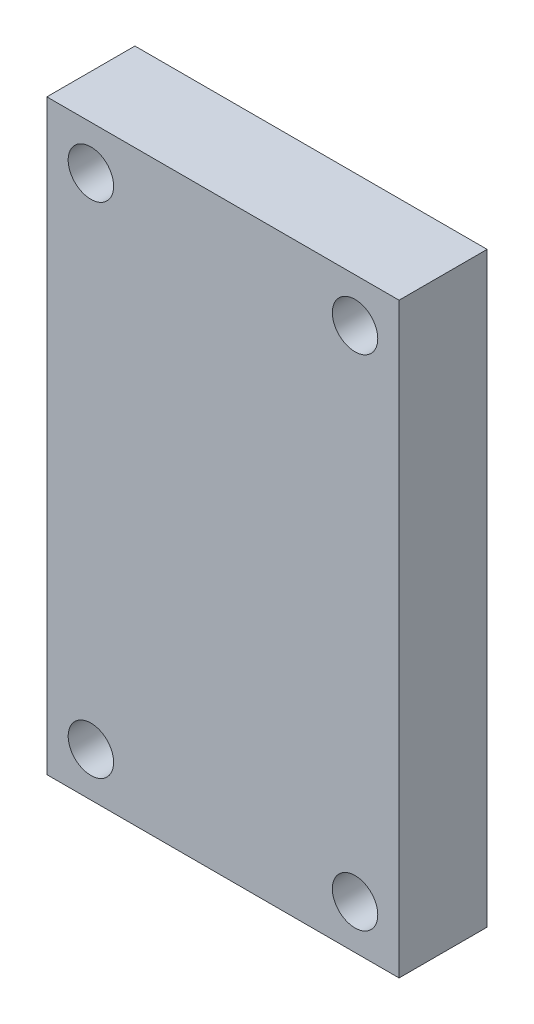
from build123d import *

# Parameters (mm, degrees)
SKETCH1_W                    = 38.1
SKETCH1_H                    = 63.5
BOSS_EXTRUDE1_DEPTH          = 9.525
F_10_0_1935_DIAMETER_HOLE1_D = 4.9149


with BuildPart() as part:
    # Sketch1 → Boss-Extrude1 (new body)
    with BuildSketch(Plane.XY):
        with Locations((19.05, 31.75)):
            Rectangle(SKETCH1_W, SKETCH1_H)
    extrude(amount=BOSS_EXTRUDE1_DEPTH)

    # #10 (0.1935) Diameter Hole1 (through all)
    with Locations(Plane.XY.offset(9.525)):
        with Locations((4.7625, 58.7375), (33.3375, 58.7375), (4.7625, 4.7625), (33.3375, 4.7625)):
            Hole(F_10_0_1935_DIAMETER_HOLE1_D / 2)


solid = part.part
